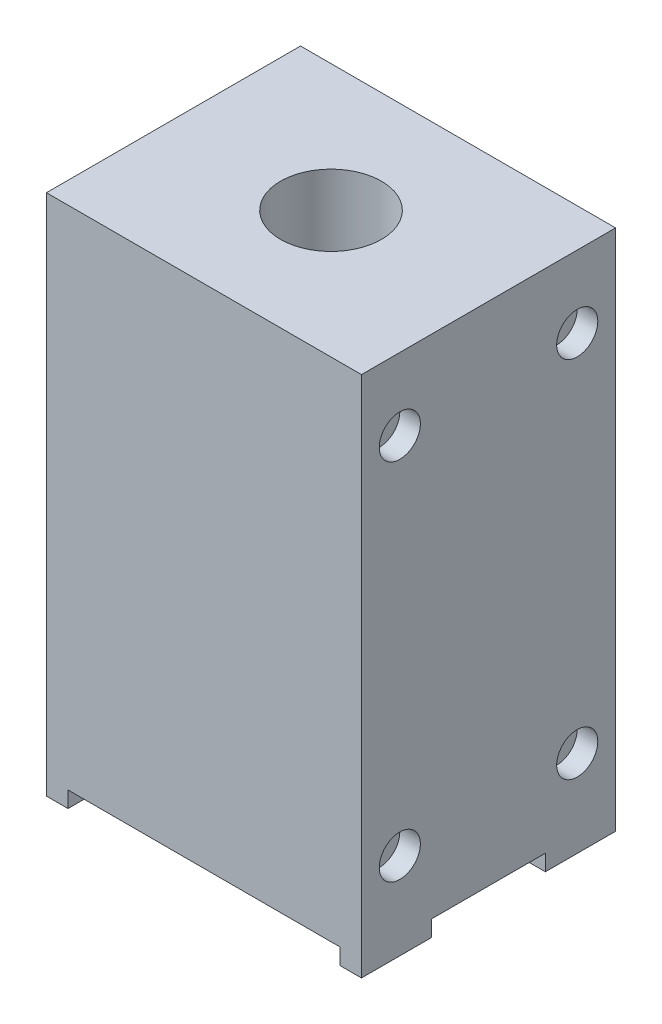
from build123d import *

# Parameters (mm, degrees)
BOSS_EXTRUDE1_DEPTH = 49.27
SKETCH12_W          = 2.099999999999998
SKETCH12_H          = 6.83
SKETCH12_W_2        = 2.0999999999999996
SKETCH12_H_2        = 6.829999999999998
SKETCH12_W_3        = 2.1000000000000014
BOSS_EXTRUDE2_DEPTH = 1.57
SKETCH4_R           = 4.91
CUT_EXTRUDE3_DEPTH  = 22
SKETCH5_R           = 2
CUT_EXTRUDE4_DEPTH  = 5
SKETCH7_R           = 1.5
CUT_EXTRUDE5_DEPTH  = 34.41594267711148
FILLET4_R           = 3
FILLET5_R           = 3
SKETCH13_R          = 2.000000000000001
SKETCH13_R_2        = 2
SKETCH13_R_3        = 2.0000000000000004
SKETCH13_R_4        = 1.9999999999999996
CUT_EXTRUDE6_DEPTH  = 2


with BuildPart() as part:
    # Sketch2 → Boss-Extrude1 (new body)
    with BuildSketch(Plane(origin=(0, 0, 0), x_dir=(1, 0, 0), z_dir=(0, 1, 0))):
        Polygon((-15.325000000000001, 12.36), (15.324999999999998, 12.36), (15.325, -12.360000000000003), (-15.324999999999996, -12.360000000000003), align=None)
    extrude(amount=BOSS_EXTRUDE1_DEPTH)

    # Sketch12 → Boss-Extrude2 (add)
    with BuildSketch(Plane.XZ):
        with Locations((-14.274999999999997, 8.945000000000004)):
            Rectangle(SKETCH12_W, SKETCH12_H)
        with Locations((-14.275000000000002, -8.944999999999999)):
            Rectangle(SKETCH12_W_2, SKETCH12_H_2)
        with Locations((14.274999999999999, 8.945000000000004)):
            Rectangle(SKETCH12_W_3, SKETCH12_H)
        with Locations((14.274999999999999, -8.944999999999999)):
            Rectangle(SKETCH12_W_3, SKETCH12_H_2)
    extrude(amount=BOSS_EXTRUDE2_DEPTH)

    # Sketch4 → Cut-Extrude3 (cut)
    with BuildSketch(Plane(origin=(0, 49.27, 0), x_dir=(1, 0, 0), z_dir=(0, 1, 0))):
        with Locations(Location((0, 0, 0), (0, 0, 270))):
            Circle(SKETCH4_R)
    extrude(amount=-CUT_EXTRUDE3_DEPTH, mode=Mode.SUBTRACT)

    # Sketch5 → Cut-Extrude4 (cut)
    with BuildSketch(Plane(origin=(0, 27.270000000000003, 0), x_dir=(1, 0, 0), z_dir=(0, 1, 0))):
        with Locations(Location((0, 0, 0), (0, 0, 270))):
            Circle(SKETCH5_R)
    extrude(amount=-CUT_EXTRUDE4_DEPTH, mode=Mode.SUBTRACT)

    # Sketch7 → Cut-Extrude5 (cut, through all)
    with BuildSketch(Plane(origin=(0, 22.270000000000003, 0), x_dir=(1, 0, 0), z_dir=(0, 1, 0))):
        with Locations(Location((0, 0, 0), (0, 0, 270))):
            Circle(SKETCH7_R)
    extrude(amount=-CUT_EXTRUDE5_DEPTH, mode=Mode.SUBTRACT)

    # Fillet4
    # the kernel refuses this fillet: 3 mm, written as the material it takes off along each edge
    with BuildSketch(Plane(origin=(0, 27.270000000000003, 0), x_dir=(-1.8e-16, 0, 1), z_dir=(-1, 0, -1.8e-16))) as fillet4_piece_1:
        with BuildLine():
            CenterArc((5, -2.9986496961132367), FILLET4_R, 91.7191313208778, 88.2808686791222)
            Line((2, -2.9986496961132367), (1.94, -2.9986496961132367))
            Line((1.94, -2.9986496961132367), (1.94, 0))
            Line((1.94, 0), (2, 0.05999999999999872))
            ThreePointArc((2, 0.05999999999999872), (3.455, 0.05999999999999872), (4.9082, 0.05997299392226552))
            Line((4.9082, 0.05997299392226552), (4.91, 0))
        make_face()
    revolve(axis=Axis((0, 27.270000000000003, 0), (0, 1, 0)), mode=Mode.SUBTRACT)

    # Fillet5
    # the kernel refuses this fillet: 3 mm, written as the material it takes off along each edge
    with BuildSketch(Plane(origin=(0, 22.270000000000003, 0), x_dir=(-1.8e-16, 0, 1), z_dir=(-1, 0, -1.8e-16))) as fillet5_piece_1:
        with BuildLine():
            CenterArc((4.5, -1.6583123951831418), FILLET5_R, 146.44269023799268, 33.55730976200732)
            Line((2.0000000000025064, -1.66267e-12), (1.9500000000025566, 0.03316624790196698))
            ThreePointArc((1.9500000000025566, 0.03316624790196698), (1.7500000000012532, 0.05999999999999872), (1.5, 0.05999999999999872))
            Line((1.5, 0.05999999999999872), (1.44, 0))
            Line((1.44, 0), (1.44, -1.6583123951831418))
            Line((1.44, -1.6583123951831418), (1.5, -1.6583123951831418))
        make_face()
    revolve(axis=Axis((0, 22.270000000000003, 0), (0, 1, 0)), mode=Mode.SUBTRACT)

    # Sketch13 → Cut-Extrude6 (cut)
    with BuildSketch(Plane(origin=(15.324999999999998, 0, -1.08e-15), x_dir=(-7e-17, 0, -1), z_dir=(1, 0, -7e-17))):
        with Locations((-8.630000000000006, 42.27)):
            Circle(SKETCH13_R)
        with Locations((8.629999999999999, 42.27)):
            Circle(SKETCH13_R_2)
        with Locations((-8.630000000000006, 6.870000000000001)):
            Circle(SKETCH13_R_3)
        with Locations((8.629999999999999, 6.870000000000001)):
            Circle(SKETCH13_R_4)
    extrude(amount=-CUT_EXTRUDE6_DEPTH, mode=Mode.SUBTRACT)


solid = part.part
